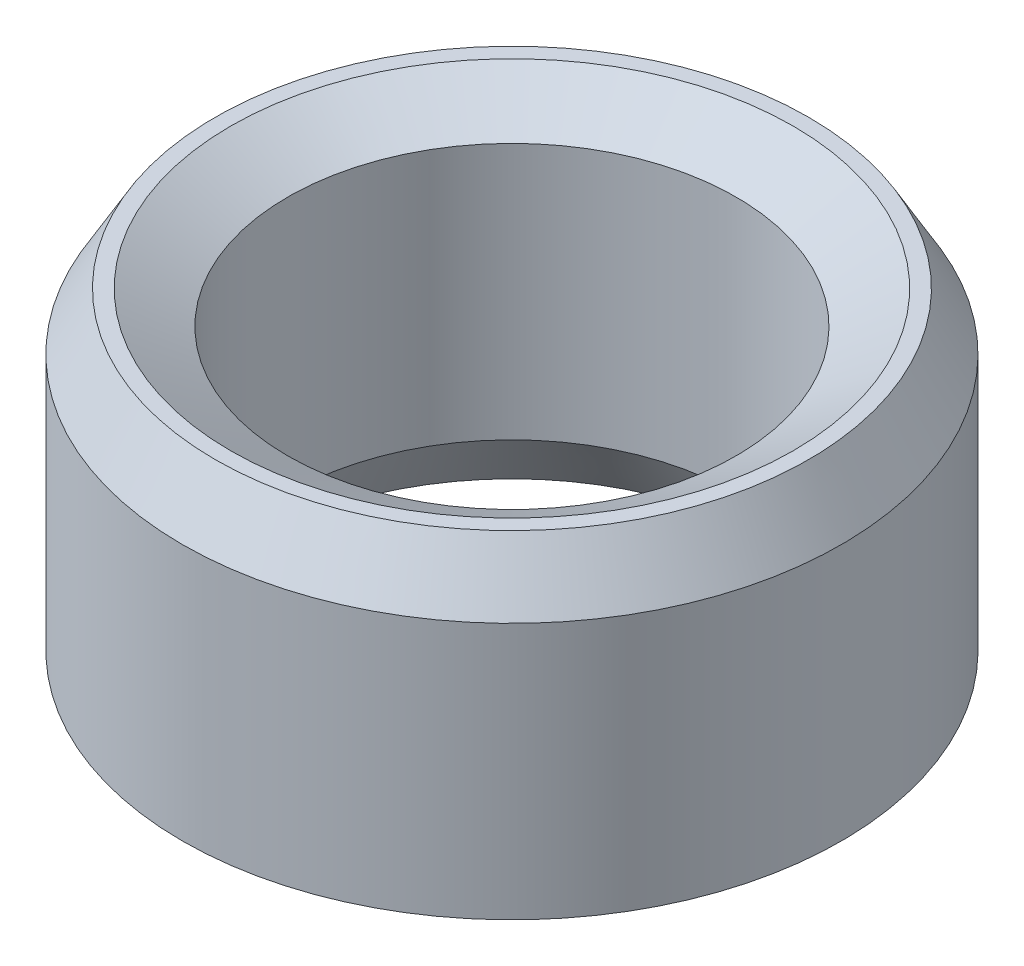
from build123d import *
from OCP.BRepFilletAPI import BRepFilletAPI_MakeChamfer

# Parameters (mm, degrees)
SKETCH1_R           = 10
BOSS_EXTRUDE1_DEPTH = 10.520229828
SKETCH2_R           = 6.80325701
CUT_EXTRUDE1_DEPTH  = 18.625981835
CHAMFER1_SIZE       = 1.730906712
CHAMFER1_SIZE2      = 0.999339456


with BuildPart() as part:
    # Sketch1 → Boss-Extrude1 (new body)
    with BuildSketch(Plane(origin=(0, 0, 0), x_dir=(1, 0, 0), z_dir=(0, 1, 0))):
        Circle(SKETCH1_R)
    extrude(amount=BOSS_EXTRUDE1_DEPTH)

    # Sketch2 → Cut-Extrude1 (cut, through all)
    with BuildSketch(Plane(origin=(0, 0, 0), x_dir=(1, 0, 0), z_dir=(0, 1, 0))):
        Circle(SKETCH2_R)
    extrude(amount=CUT_EXTRUDE1_DEPTH, mode=Mode.SUBTRACT)

    # Chamfer1: one chamfer whose edges measure the first distance from different faces: ONE call of the kernel's chamfer builder (chamfer() names one face for all edges)
    chamfer1_edges_1 = [part.edges().sort_by_distance(p)[0] for p in [
        (-6.80325701, 10.520229828, 0),
    ]]
    chamfer1_side_1 = [part.faces().sort_by_distance(p)[0] for p in [
        (-9.717157288, 10.520229828, 0),
    ]]
    chamfer1_edges_2 = [part.edges().sort_by_distance(p)[0] for p in [
        (-6.80325701, 0, 0),
    ]]
    chamfer1_side_2 = [part.faces().sort_by_distance(p)[0] for p in [
        (-6.80325701, 5.260114914, 0),
    ]]
    chamfer1_edges_3 = [part.edges().sort_by_distance(p)[0] for p in [
        (-10, 0, 0),
    ]]
    chamfer1_side_3 = [part.faces().sort_by_distance(p)[0] for p in [
        (-9.717157288, 0, 0),
    ]]
    chamfer1_edges_4 = [part.edges().sort_by_distance(p)[0] for p in [
        (-10, 10.520229828, 0),
    ]]
    chamfer1_side_4 = [part.faces().sort_by_distance(p)[0] for p in [
        (-10, 5.260114914, 0),
    ]]
    chamfer1 = BRepFilletAPI_MakeChamfer(part.part.solid().wrapped)
    for e in chamfer1_edges_1:
        chamfer1.Add(CHAMFER1_SIZE, CHAMFER1_SIZE2, e.wrapped, chamfer1_side_1[0].wrapped)  # the first distance lies on this face
    for e in chamfer1_edges_2:
        chamfer1.Add(CHAMFER1_SIZE, CHAMFER1_SIZE2, e.wrapped, chamfer1_side_2[0].wrapped)  # the first distance lies on this face
    for e in chamfer1_edges_3:
        chamfer1.Add(CHAMFER1_SIZE, CHAMFER1_SIZE2, e.wrapped, chamfer1_side_3[0].wrapped)  # the first distance lies on this face
    for e in chamfer1_edges_4:
        chamfer1.Add(CHAMFER1_SIZE, CHAMFER1_SIZE2, e.wrapped, chamfer1_side_4[0].wrapped)  # the first distance lies on this face
    add(Compound.cast(chamfer1.Shape()), mode=Mode.REPLACE)


solid = part.part
